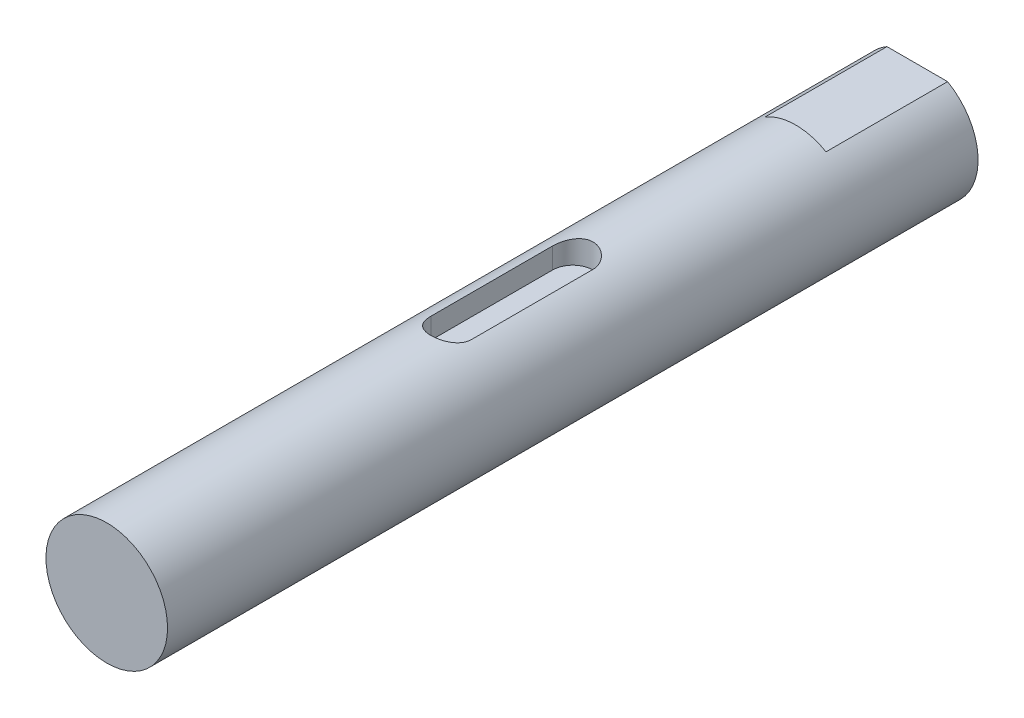
from build123d import *

# Parameters (mm, degrees)
SKETCH1_R           = 7.5
BOSS_EXTRUDE1_DEPTH = 50
SKETCH2_W           = 5
SKETCH2_H           = 5
CUT_EXTRUDE1_DEPTH  = 10
FILLET1_R           = 2.5
FILLET2_R           = 2.5
CUT_EXTRUDE2_START  = -15
CUT_EXTRUDE2_DEPTH  = 15


with BuildPart() as part:
    # Sketch1 → Boss-Extrude1 (new, symmetric)
    with BuildSketch(Plane.XY):
        Circle(SKETCH1_R)
    extrude(amount=BOSS_EXTRUDE1_DEPTH, both=True)

    # Sketch2 → Cut-Extrude1 (cut, symmetric)
    with BuildSketch(Plane.XY):
        with Locations((0, 7)):
            Rectangle(SKETCH2_W, SKETCH2_H)
    extrude(amount=CUT_EXTRUDE1_DEPTH, both=True, mode=Mode.SUBTRACT)

    # Fillet1
    fillet1_edges = [part.edges().sort_by_distance(p)[0] for p in [
        (-2.5, 5.785533906, -10),
        (2.5, 5.785533906, -10),
    ]]
    fillet(fillet1_edges, radius=FILLET1_R - 0.0001)  # a hair under: the kernel refuses the full size

    # Fillet2
    fillet2_edges = [part.edges().sort_by_distance(p)[0] for p in [
        (-2.5, 5.785533906, 10),
        (2.5, 5.785533906, 10),
    ]]
    fillet(fillet2_edges, radius=FILLET2_R - 0.0001)  # a hair under: the kernel refuses the full size

    # Sketch3 → Cut-Extrude2 (cut)
    with BuildSketch(Plane(origin=(0, 0, -50), x_dir=(-1, 0, 0), z_dir=(0, 0, -1)).offset(CUT_EXTRUDE2_START)):
        with BuildLine():
            Line((-3.741657387, 6.5), (3.741657387, 6.5))
            ThreePointArc((3.741657387, 6.5), (0, 7.5), (-3.741657387, 6.5))
        make_face()
        with BuildLine():
            Line((6.5, -3.741657387), (6.5, 3.741657387))
            ThreePointArc((6.5, 3.741657387), (7.5, 0), (6.5, -3.741657387))
        make_face()
    extrude(amount=CUT_EXTRUDE2_DEPTH, mode=Mode.SUBTRACT)


solid = part.part
